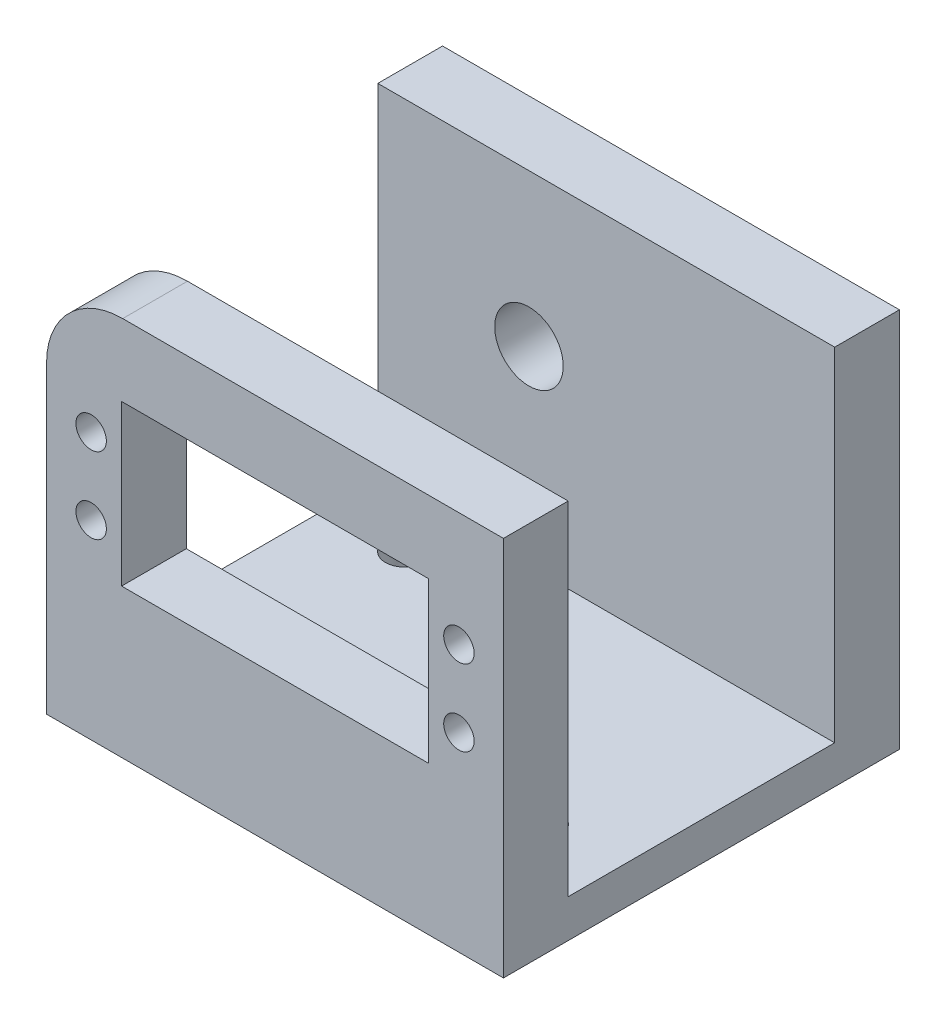
from build123d import *

# Parameters (mm, degrees)
SKETCH1_W           = 60
SKETCH1_H           = 50
BOSS_EXTRUDE1_DEPTH = 52
SKETCH2_W           = 35
SKETCH2_H           = 45
CUT_EXTRUDE1_DEPTH  = 94.829632846
SKETCH3_R           = 2
SKETCH3_W           = 40.3
SKETCH3_H           = 21
CUT_EXTRUDE2_DEPTH  = 10
SKETCH4_R           = 4.5
CUT_EXTRUDE3_DEPTH  = 10
SKETCH5_R           = 2.5
CUT_EXTRUDE4_DEPTH  = 10
FILLET1_R           = 10


with BuildPart() as part:
    # Sketch1 → Boss-Extrude1 (new body)
    with BuildSketch(Plane.XY):
        with Locations((-30, 25)):
            Rectangle(SKETCH1_W, SKETCH1_H)
    extrude(amount=BOSS_EXTRUDE1_DEPTH)

    # Sketch2 → Cut-Extrude1 (cut, through all)
    with BuildSketch(Plane(origin=(0, 0, 0), x_dir=(0, 0, -1), z_dir=(1, 0, 0))):
        with Locations((-26, 27.5)):
            Rectangle(SKETCH2_W, SKETCH2_H)
    extrude(amount=-CUT_EXTRUDE1_DEPTH, mode=Mode.SUBTRACT)

    # Sketch3 → Cut-Extrude2 (cut)
    with BuildSketch(Plane.XY.offset(52)):
        with Locations((-54.15, 35)):
            Circle(SKETCH3_R)
        with Locations((-5.85, 35)):
            Circle(SKETCH3_R)
        with Locations((-54.15, 25)):
            Circle(SKETCH3_R)
        with Locations((-5.85, 25)):
            Circle(SKETCH3_R)
        with Locations((-30, 30)):
            Rectangle(SKETCH3_W, SKETCH3_H)
    extrude(amount=-CUT_EXTRUDE2_DEPTH, mode=Mode.SUBTRACT)

    # Sketch4 → Cut-Extrude3 (cut)
    with BuildSketch(Plane.XY.offset(8.5)):
        with Locations((-40.15, 30)):
            Circle(SKETCH4_R)
    extrude(amount=-CUT_EXTRUDE3_DEPTH, mode=Mode.SUBTRACT)

    # Sketch5 → Cut-Extrude4 (cut)
    with BuildSketch(Plane(origin=(0, 5, 0), x_dir=(1, 0, 0), z_dir=(0, 1, 0))):
        with Locations((-50, -15)):
            Circle(SKETCH5_R)
        with Locations((-10, -37)):
            Circle(SKETCH5_R)
    extrude(amount=-CUT_EXTRUDE4_DEPTH, mode=Mode.SUBTRACT)

    # Fillet1
    fillet1_edges = [part.edges().sort_by_distance(p)[0] for p in [
        (-60, 50, 47.75),
    ]]
    fillet(fillet1_edges, radius=FILLET1_R)


solid = part.part
